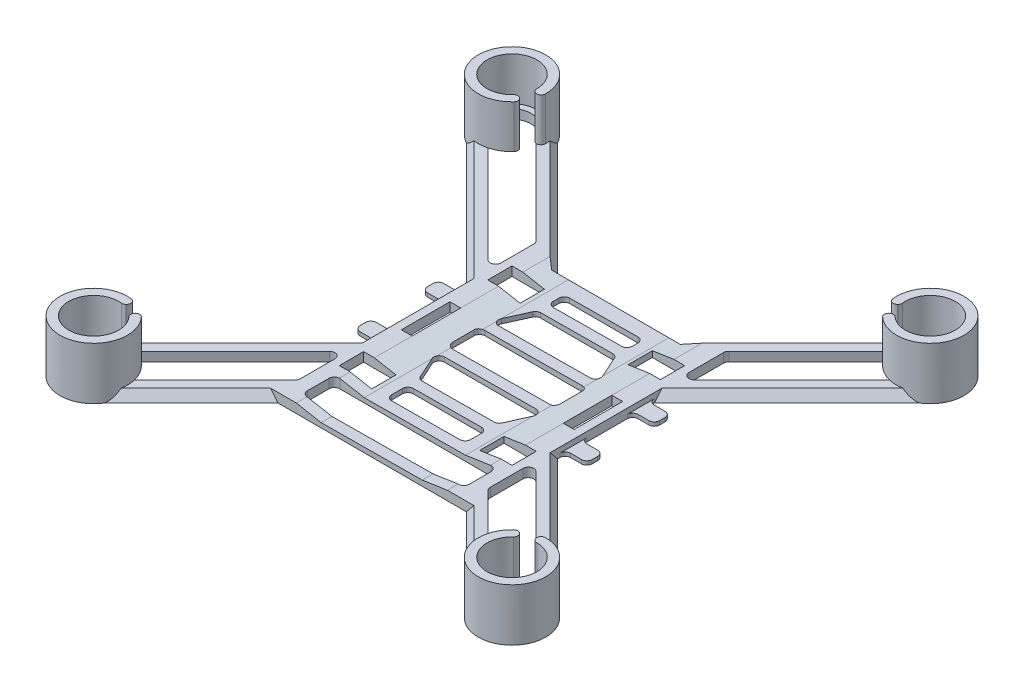
from build123d import *
from build123d.topology import SkipClean

# Parameters (mm, degrees)
ESBO_O1_W                = 90
ESBO_O1_H                = 90
RESSALTO_EXTRUS_O1_DEPTH = 1.7
ESBO_O2_R                = 6.25
ESBO_O2_R_2              = 4.625
RESSALTO_EXTRUS_O2_DEPTH = 8
FILETE1_R                = 6.25
CORTE_EXTRUS_O1_DEPTH    = 15
ESBO_O11_W               = 6
ESBO_O11_H               = 4.5
ESBO_O11_W_2             = 2
ESBO_O11_H_2             = 9
CORTE_EXTRUS_O8_DEPTH    = 20
CORTE_EXTRUS_O11_DEPTH   = 23
CHANFRO2_SIZE            = 2
CHANFRO2_SIZE_2          = 1.154700538
ESBO_O23_W               = 4
ESBO_O23_H               = 3
RESSALTO_EXTRUS_O6_DEPTH = 1.7
ESBO_O25_W               = 30
ESBO_O25_H               = 6
ESBO_O25_W_2             = 14.632060808
ESBO_O25_H_2             = 4
ESBO_O25_W_3             = 20
ESBO_O25_H_3             = 3.022980672
CORTE_EXTRUS_O16_DEPTH   = 34
CHANFRO4_SIZE            = 2
CORTE_EXTRUS_O20_DEPTH   = 4
FILETE5_R                = 1
FILETE6_R                = 1
FILETE7_R                = 1
CORTE_EXTRUS_O21_DEPTH   = 85.599955679
ESBO_O30_W               = 4.624602657
ESBO_O30_H               = 17.599663355
ESBO_O30_W_2             = 4.720585126
ESBO_O30_H_2             = 17.916049933
CORTE_EXTRUS_O25_DEPTH   = 1
FILETE8_R                = 0.8


with BuildPart() as part:
    # Esboço1 → Ressalto-extrusão1 (new body)
    with BuildSketch(Plane(origin=(0, 0, 0), x_dir=(1, 0, 0), z_dir=(0, 1, 0))):
        Rectangle(ESBO_O1_W, ESBO_O1_H)
    extrude(amount=RESSALTO_EXTRUS_O1_DEPTH)

    # Esboço2 → Ressalto-extrusão2 (add)
    # profile 1 of 4: a face of its own
    with BuildSketch(Plane(origin=(0, 1.7, 0), x_dir=(1, 0, 0), z_dir=(0, 1, 0))):
        with Locations(Location((-38.75, 38.75, 0), (0, 0, 90))):
            Circle(ESBO_O2_R)
        with Locations(Location((-38.75, 38.75, 0), (0, 0, 270))):
            Circle(ESBO_O2_R_2, mode=Mode.SUBTRACT)
    # profile 2 of 4: a face of its own
    with BuildSketch(Plane(origin=(0, 1.7, 0), x_dir=(1, 0, 0), z_dir=(0, 1, 0))):
        with Locations(Location((38.75, 38.75, 0), (0, 0, 90))):
            Circle(ESBO_O2_R)
        with Locations(Location((38.75, 38.75, 0), (0, 0, 270))):
            Circle(ESBO_O2_R_2, mode=Mode.SUBTRACT)
    # profile 3 of 4: a face of its own
    with BuildSketch(Plane(origin=(0, 1.7, 0), x_dir=(1, 0, 0), z_dir=(0, 1, 0))):
        with Locations(Location((38.75, -38.75, 0), (0, 0, 270))):
            Circle(ESBO_O2_R)
        with Locations(Location((38.75, -38.75, 0), (0, 0, 270))):
            Circle(ESBO_O2_R_2, mode=Mode.SUBTRACT)
    # profile 4 of 4: a face of its own
    with BuildSketch(Plane(origin=(0, 1.7, 0), x_dir=(1, 0, 0), z_dir=(0, 1, 0))):
        with Locations(Location((-38.75, -38.75, 0), (0, 0, 270))):
            Circle(ESBO_O2_R)
        with Locations(Location((-38.75, -38.75, 0), (0, 0, 270))):
            Circle(ESBO_O2_R_2, mode=Mode.SUBTRACT)
    extrude(amount=RESSALTO_EXTRUS_O2_DEPTH)

    # Filete1
    filete1_edges = [part.edges().sort_by_distance(p)[0] for p in [
        (-45, 0.85, -45),
        (45, 0.85, -45),
        (45, 0.85, 45),
        (-45, 0.85, 45),
    ]]
    fillet(filete1_edges, radius=FILETE1_R)

    # Esboço3 → Corte-extrusão1 (cut)
    with BuildSketch(Plane(origin=(0, 1.7, 0), x_dir=(1, 0, 0), z_dir=(0, 1, 0))):
        Polygon((0.306619532, 3.948336601), (37.223452225, 40.865169294), (38.637665788, 39.450955731), (1.720833095, 2.534123038), (40.877478067, -36.622521933), (39.463264504, -38.036735496), (0.306619532, 1.119909476), (-39.356434012, -38.543144069), (-40.770647575, -37.128930506), (-1.10759403, 2.534123038), (-37.799805314, 39.226334322), (-36.385591752, 40.640547885), align=None)
    extrude(amount=CORTE_EXTRUS_O1_DEPTH, mode=Mode.SUBTRACT)

    # Esboço11 → Corte-extrusão8 (cut)
    with BuildSketch(Plane(origin=(0, 1.7, 0), x_dir=(1, 0, 0), z_dir=(0, 1, 0))):
        with Locations((-13, -13.75)):
            Rectangle(ESBO_O11_W, ESBO_O11_H)
        with Locations((-15, 0)):
            Rectangle(ESBO_O11_W_2, ESBO_O11_H_2)
        with Locations((-13, 13.75)):
            Rectangle(ESBO_O11_W, ESBO_O11_H)
        with Locations((13, -13.75)):
            Rectangle(ESBO_O11_W, ESBO_O11_H)
        with Locations((15, 0)):
            Rectangle(ESBO_O11_W_2, ESBO_O11_H_2)
        with Locations((13, 13.75)):
            Rectangle(ESBO_O11_W, ESBO_O11_H)
    extrude(amount=-CORTE_EXTRUS_O8_DEPTH, mode=Mode.SUBTRACT)

    # Esboço14 → Corte-extrusão11 (cut)
    with SkipClean():  # the faces are left unmerged after this step: merging them gives an invalid solid
        with BuildSketch(Plane(origin=(0, 1.7, 0), x_dir=(1, 0, 0), z_dir=(0, 1, 0))):
            with BuildLine():
                Line((-45, 38.75), (-45, -38.75))
                ThreePointArc((-45, -38.75), (-44.494719449, -36.288151415), (-43.060576494, -34.224358577))
                Line((-43.060576494, -34.224358577), (-17.5, -8.663782083))
                Line((-17.5, -8.663782083), (-17.5, 8.814606578))
                Line((-17.5, 8.814606578), (-42.27279716, 33.587403737))
                ThreePointArc((-42.27279716, 33.587403737), (-44.276299949, 35.830666365), (-45, 38.75))
            make_face()
            with BuildLine():
                Line((38.75, 45), (-38.75, 45))
                ThreePointArc((-38.75, 45), (-35.830666365, 44.276299949), (-33.587403737, 42.27279716))
                Line((-33.587403737, 42.27279716), (-12.314606578, 21))
                Line((-12.314606578, 21), (12.163782083, 21))
                Line((12.163782083, 21), (34.224358577, 43.060576494))
                ThreePointArc((34.224358577, 43.060576494), (36.288151415, 44.494719449), (38.75, 45))
            make_face()
            with BuildLine():
                Line((17.5, -8.814606578), (42.27279716, -33.587403737))
                ThreePointArc((42.27279716, -33.587403737), (44.276299949, -35.830666365), (45, -38.75))
                Line((45, -38.75), (45, 38.75))
                ThreePointArc((45, 38.75), (44.494719449, 36.288151415), (43.060576494, 34.224358577))
                Line((43.060576494, 34.224358577), (17.5, 8.663782083))
                Line((17.5, 8.663782083), (17.5, -8.814606578))
            make_face()
            with BuildLine():
                Line((-17.143092455, -25.979310372), (-34.224358577, -43.060576494))
                ThreePointArc((-34.224358577, -43.060576494), (-36.288151415, -44.494719449), (-38.75, -45))
                Line((-38.75, -45), (38.75, -45))
                ThreePointArc((38.75, -45), (35.830666365, -44.276299949), (33.587403737, -42.27279716))
                Line((33.587403737, -42.27279716), (17.293916949, -25.979310372))
                Line((17.293916949, -25.979310372), (-17.143092455, -25.979310372))
            make_face()
        extrude(amount=-CORTE_EXTRUS_O11_DEPTH, mode=Mode.SUBTRACT)

    # Chanfro2
    # the kernel refuses this chamfer: 2, 1.154700538 mm, written as the material it takes off along each edge
    with BuildSketch(Plane(origin=(13.841308239, 1.7, 5.155914816), x_dir=(0.013666087023143484, -0.9998132206222079, -0.013666087023143503), z_dir=(0.7071067811865481, 0, 0.7071067811865471))) as chanfro2_piece_1_section:
        Polygon((CHANFRO2_SIZE * 0.999813220622, -CHANFRO2_SIZE * 0.0193267656127), (-CHANFRO2_SIZE_2 * 0.019326765619, -CHANFRO2_SIZE_2 * 0.999813220951), (0, 0), align=None)
    chanfro2_piece_1 = extrude(amount=45.38236874, mode=Mode.PRIVATE)
    chanfro2_piece_1 = chanfro2_piece_1 - Plane(origin=(38.75, 1.053820833, 38.75), x_dir=(0.5636475455879814, 0, -0.8260154020069145), z_dir=(0, 1, 0)) * Cylinder(6.25, 99, mode=Mode.PRIVATE)
    chanfro2_piece_1 = split(chanfro2_piece_1, bisect_by=Plane(origin=(17.5, 1.053820833, 21.194590226), z_dir=(1, 0, 0)), keep=Keep.TOP, mode=Mode.PRIVATE)
    add(chanfro2_piece_1, mode=Mode.SUBTRACT)
    with BuildSketch(Plane(origin=(-46.719268256, 1.7, 37.883050339), x_dir=(-0.01366608702314486, -0.9998132206222079, -0.01366608702314513), z_dir=(0.7071067811865546, 0, -0.7071067811865406))) as chanfro2_piece_2_section:
        Polygon((CHANFRO2_SIZE * 0.999813220622, -CHANFRO2_SIZE * 0.0193267656127), (-CHANFRO2_SIZE_2 * 0.0193267656191, -CHANFRO2_SIZE_2 * 0.999813220951), (0, 0), align=None)
    chanfro2_piece_2 = extrude(amount=46.496456959, mode=Mode.PRIVATE)
    chanfro2_piece_2 = split(chanfro2_piece_2, bisect_by=Plane(origin=(-17.5, 1.053166825, 21.199518697), z_dir=(-1, 0, 0)), keep=Keep.TOP, mode=Mode.PRIVATE)
    chanfro2_piece_2 = chanfro2_piece_2 - Plane(origin=(-38.75, 1.053166825, 38.75), x_dir=(-1, 0, 0), z_dir=(0, 1, 0)) * Cylinder(6.25, 101, mode=Mode.PRIVATE)
    add(chanfro2_piece_2, mode=Mode.SUBTRACT)
    with BuildSketch(Plane(origin=(-37.246095499, 1.7, -45.931488921), x_dir=(0.013666087023144997, -0.9998132206222079, -0.013666087023144993), z_dir=(0.7071067811865475, 0, 0.7071067811865477))) as chanfro2_piece_3_section:
        Polygon((CHANFRO2_SIZE * 0.999813220622, -CHANFRO2_SIZE * 0.0193267656127), (-CHANFRO2_SIZE_2 * 0.0193267656191, -CHANFRO2_SIZE_2 * 0.999813220951), (0, 0), align=None)
    chanfro2_piece_3 = extrude(amount=40.432621272, mode=Mode.PRIVATE)
    chanfro2_piece_3 = chanfro2_piece_3 - Plane(origin=(-38.75, 1.052848375, -38.75), x_dir=(0, 0, -1), z_dir=(0, 1, 0)) * Cylinder(6.25, 89, mode=Mode.PRIVATE)
    chanfro2_piece_3 = split(chanfro2_piece_3, bisect_by=Plane(origin=(-22.944314713, 1.052848375, -21), z_dir=(0, 0, -1)), keep=Keep.TOP, mode=Mode.PRIVATE)
    add(chanfro2_piece_3, mode=Mode.SUBTRACT)
    with BuildSketch(Plane(origin=(8.505090322, 1.7, -17.341308239), x_dir=(-0.013666087023142625, -0.9998132206222079, -0.013666087023143075), z_dir=(0.7071067811865591, 0, -0.7071067811865359))) as chanfro2_piece_4_section:
        Polygon((CHANFRO2_SIZE * 0.999813220622, -CHANFRO2_SIZE * 0.0193267656127), (-CHANFRO2_SIZE_2 * 0.019326765619, -CHANFRO2_SIZE_2 * 0.999813220951), (0, 0), align=None)
    chanfro2_piece_4 = extrude(amount=41.546709491, mode=Mode.PRIVATE)
    chanfro2_piece_4 = chanfro2_piece_4 - Plane(origin=(38.75, 1.052097169, -38.75), x_dir=(-0.7241026276337036, 0, -0.6896922390849168), z_dir=(0, 1, 0)) * Cylinder(6.25, 92, mode=Mode.PRIVATE)
    chanfro2_piece_4 = split(chanfro2_piece_4, bisect_by=Plane(origin=(22.9494905, 1.052097169, -21), z_dir=(0, 0, -1)), keep=Keep.TOP, mode=Mode.PRIVATE)
    add(chanfro2_piece_4, mode=Mode.SUBTRACT)
    with BuildSketch(Plane(origin=(-13.841308239, 1.7, -5.155914816), x_dir=(-0.01366608702314327, -0.9998132206222079, 0.013666087023143286), z_dir=(-0.7071067811865479, 0, -0.7071067811865471))) as chanfro2_piece_5_section:
        Polygon((CHANFRO2_SIZE * 0.999813220622, -CHANFRO2_SIZE * 0.0193267656127), (-CHANFRO2_SIZE_2 * 0.019326765619, -CHANFRO2_SIZE_2 * 0.999813220951), (0, 0), align=None)
    chanfro2_piece_5 = extrude(amount=45.38236874, mode=Mode.PRIVATE)
    chanfro2_piece_5 = chanfro2_piece_5 - Plane(origin=(-38.75, 1.053820833, -38.75), x_dir=(-0.5636475455879961, 0, 0.8260154020069045), z_dir=(0, 1, 0)) * Cylinder(6.25, 99, mode=Mode.PRIVATE)
    chanfro2_piece_5 = split(chanfro2_piece_5, bisect_by=Plane(origin=(-17.5, 1.053820833, -21.194590226), z_dir=(-1, 0, 0)), keep=Keep.TOP, mode=Mode.PRIVATE)
    add(chanfro2_piece_5, mode=Mode.SUBTRACT)
    with BuildSketch(Plane(origin=(46.719268256, 1.7, -37.883050339), x_dir=(0.013666087023146853, -0.9998132206222079, 0.013666087023146572), z_dir=(-0.7071067811865402, 0, 0.7071067811865549))) as chanfro2_piece_6_section:
        Polygon((CHANFRO2_SIZE * 0.999813220622, -CHANFRO2_SIZE * 0.0193267656127), (-CHANFRO2_SIZE_2 * 0.0193267656191, -CHANFRO2_SIZE_2 * 0.999813220951), (0, 0), align=None)
    chanfro2_piece_6 = extrude(amount=46.496456959, mode=Mode.PRIVATE)
    chanfro2_piece_6 = split(chanfro2_piece_6, bisect_by=Plane(origin=(17.5, 1.053166825, -21.199518697), z_dir=(1, 0, 0)), keep=Keep.TOP, mode=Mode.PRIVATE)
    chanfro2_piece_6 = chanfro2_piece_6 - Plane(origin=(38.75, 1.053166825, -38.75), x_dir=(1, 0, 0), z_dir=(0, 1, 0)) * Cylinder(6.25, 101, mode=Mode.PRIVATE)
    add(chanfro2_piece_6, mode=Mode.SUBTRACT)
    with BuildSketch(Plane(origin=(37.246095499, 1.7, 45.931488921), x_dir=(-0.013666087023144995, -0.9998132206222079, 0.013666087023144995), z_dir=(-0.7071067811865476, 0, -0.7071067811865476))) as chanfro2_piece_7_section:
        Polygon((CHANFRO2_SIZE * 0.999813220622, -CHANFRO2_SIZE * 0.0193267656127), (-CHANFRO2_SIZE_2 * 0.0193267656191, -CHANFRO2_SIZE_2 * 0.999813220951), (0, 0), align=None)
    chanfro2_piece_7 = extrude(amount=33.390813013, mode=Mode.PRIVATE)
    chanfro2_piece_7 = split(chanfro2_piece_7, bisect_by=Plane(origin=(25.433358905, 1.050691799, 25.979310372), z_dir=(0, 0, 1)), keep=Keep.TOP, mode=Mode.PRIVATE)
    chanfro2_piece_7 = chanfro2_piece_7 - Plane(origin=(38.75, 1.050691799, 38.75), x_dir=(0, 0, 1), z_dir=(0, 1, 0)) * Cylinder(6.25, 75, mode=Mode.PRIVATE)
    add(chanfro2_piece_7, mode=Mode.SUBTRACT)
    with BuildSketch(Plane(origin=(-13.484400694, 1.7, 22.320618611), x_dir=(0.013666087023143193, -0.9998132206222079, 0.013666087023143364), z_dir=(-0.707106781186552, 0, 0.7071067811865431))) as chanfro2_piece_8_section:
        Polygon((CHANFRO2_SIZE * 0.999813220622, -CHANFRO2_SIZE * 0.0193267656127), (-CHANFRO2_SIZE_2 * 0.019326765619, -CHANFRO2_SIZE_2 * 0.999813220951), (0, 0), align=None)
    chanfro2_piece_8 = extrude(amount=34.504901231, mode=Mode.PRIVATE)
    chanfro2_piece_8 = chanfro2_piece_8 - Plane(origin=(-38.75, 1.049741993, 38.75), x_dir=(0.7241026276342443, 0, 0.6896922390843492), z_dir=(0, 1, 0)) * Cylinder(6.25, 78, mode=Mode.PRIVATE)
    chanfro2_piece_8 = split(chanfro2_piece_8, bisect_by=Plane(origin=(-25.439083602, 1.049741993, 25.979310372), z_dir=(0, 0, 1)), keep=Keep.TOP, mode=Mode.PRIVATE)
    add(chanfro2_piece_8, mode=Mode.SUBTRACT)

    # Esboço23 → Ressalto-extrusão6 (add)
    with BuildSketch(Plane(origin=(0, 1.7, 0), x_dir=(1, 0, 0), z_dir=(0, 1, 0))):
        with Locations((-19.5, 6.356494381)):
            Rectangle(ESBO_O23_W, ESBO_O23_H)
        with Locations((19.5, 6.356494381)):
            Rectangle(ESBO_O23_W, ESBO_O23_H)
        with Locations((-19.5, -6.132098225)):
            Rectangle(ESBO_O23_W, ESBO_O23_H)
        with Locations((19.5, -6.132098225)):
            Rectangle(ESBO_O23_W, ESBO_O23_H)
    extrude(amount=-RESSALTO_EXTRUS_O6_DEPTH)

    # Esboço25 → Corte-extrusão16 (cut)
    with BuildSketch(Plane(origin=(0, 1.7, 0), x_dir=(1, 0, 0), z_dir=(0, 1, 0))):
        with Locations((0.075412247, -20.979310372)):
            Rectangle(ESBO_O25_W, ESBO_O25_H)
        with Locations((0, -13.979310372)):
            Rectangle(ESBO_O25_W_2, ESBO_O25_H_2)
        Polygon((-10.032961397, -4.013772222), (10, -4.013772222), (7.316030404, -9.979310372), (-7.316030404, -9.979310372), align=None)
        with Locations((0, 0.986227778)):
            Rectangle(ESBO_O25_W_3, ESBO_O25_H)
        Polygon((-7.316030404, 11.977019328), (7.316030404, 11.977019328), (10.015528784, 5.986227778), (-10.015528784, 5.986227778), align=None)
        with Locations((0, 15.488509664)):
            Rectangle(ESBO_O25_W_2, ESBO_O25_H_3)
    extrude(amount=-CORTE_EXTRUS_O16_DEPTH, mode=Mode.SUBTRACT)

    # Chanfro4
    # the kernel refuses this chamfer: 2 mm, written as the material it takes off along each edge
    with BuildSketch(Plane(origin=(18.940141221, 1.7, -21), x_dir=(0, 0.027495876610586403, 0.9996219169112968), z_dir=(-1, 0, 0))) as chanfro4_piece_1_section:
        Polygon((CHANFRO4_SIZE * 0.999621916911, -CHANFRO4_SIZE * 0.0274958766106), (-CHANFRO4_SIZE * 0.0274958766106, -CHANFRO4_SIZE * 0.999621916911), (0, 0), align=None)
    chanfro4_piece_1 = extrude(amount=38.031106936, mode=Mode.PRIVATE)
    chanfro4_piece_1 = split(chanfro4_piece_1, bisect_by=Plane(origin=(-4.834145698, -2.83942723, -15.592972772), z_dir=(0.6123724356957746, 0.5000000000000488, -0.6123724356957746)), keep=Keep.TOP, mode=Mode.PRIVATE)
    chanfro4_piece_1 = split(chanfro4_piece_1, bisect_by=Plane(origin=(4.683321204, -2.83942723, -15.592972772), z_dir=(-0.612372435695766, 0.5000000000000697, -0.612372435695766)), keep=Keep.TOP, mode=Mode.PRIVATE)
    add(chanfro4_piece_1, mode=Mode.SUBTRACT)

    # Esboço17 → Corte-extrusão20 (cut)
    with BuildSketch(Plane(origin=(0, 1.7, 0), x_dir=(1, 0, 0), z_dir=(0, 1, 0))):
        with BuildLine():
            Line((-40.12496322, -35.53138599), (-17.5, -12.90642277))
            Line((-17.5, -12.90642277), (-17.5, -22.09357723))
            Line((-17.5, -22.09357723), (-35.53138599, -40.12496322))
            ThreePointArc((-35.53138599, -40.12496322), (-41.224873734, -41.224873734), (-40.12496322, -35.53138599))
        make_face()
        with BuildLine():
            Line((-17.5, 13.057247265), (-17.5, 21.942752735))
            Line((-17.5, 21.942752735), (-35.437529212, 39.880281948))
            ThreePointArc((-35.437529212, 39.880281948), (-41.224873734, 41.224873734), (-39.880281948, 35.437529212))
            Line((-39.880281948, 35.437529212), (-17.5, 13.057247265))
        make_face()
        with BuildLine():
            Line((17.5, -21.942752735), (17.5, -13.057247265))
            Line((17.5, -13.057247265), (39.880281948, -35.437529212))
            ThreePointArc((39.880281948, -35.437529212), (41.224873734, -41.224873734), (35.437529212, -39.880281948))
            Line((35.437529212, -39.880281948), (17.5, -21.942752735))
        make_face()
        with BuildLine():
            Line((17.5, 12.90642277), (40.12496322, 35.53138599))
            ThreePointArc((40.12496322, 35.53138599), (41.224873734, 41.224873734), (35.53138599, 40.12496322))
            Line((35.53138599, 40.12496322), (17.5, 22.09357723))
            Line((17.5, 22.09357723), (17.5, 12.90642277))
        make_face()
    extrude(amount=-CORTE_EXTRUS_O20_DEPTH, mode=Mode.SUBTRACT)

    # Filete5
    filete5_edges = [part.edges().sort_by_distance(p)[0] for p in [
        (15.075412247, 0.85, 17.979310372),
        (15.075412247, 0.85, 23.979310372),
        (-14.924587753, 0.85, 23.979310372),
        (-14.924587753, 0.85, 17.979310372),
        (7.316030404, 0.85, 11.979310372),
        (7.316030404, 0.85, 15.979310372),
        (-7.316030404, 0.85, 15.979310372),
        (-7.316030404, 0.85, 11.979310372),
        (10, 0.85, 4.013772222),
        (7.316030404, 0.85, 9.979310372),
        (-7.316030404, 0.85, 9.979310372),
        (-10.032961397, 0.85, 4.013772222),
        (10, 0.85, -3.986227778),
        (10, 0.85, 2.013772222),
        (-10, 0.85, 2.013772222),
        (-10, 0.85, -3.986227778),
        (7.316030404, 0.85, -11.977019328),
        (10.015528784, 0.85, -5.986227778),
        (-10.015528784, 0.85, -5.986227778),
        (-7.316030404, 0.85, -11.977019328),
        (7.316030404, 0.85, -17),
        (7.316030404, 0.85, -13.977019328),
        (-7.316030404, 0.85, -13.977019328),
        (-7.316030404, 0.85, -17),
    ]]
    fillet(filete5_edges, radius=FILETE5_R)

    # Filete6
    filete6_edges = [part.edges().sort_by_distance(p)[0] for p in [
        (-17.5, 0.85, -7.856494381),
        (-17.5, 0.85, -4.856494381),
        (-17.5, 0.85, 4.632098225),
        (-17.5, 0.85, 7.632098225),
        (17.5, 0.85, -4.856494381),
        (17.5, 0.85, -7.856494381),
        (17.5, 0.85, 7.632098225),
        (17.5, 0.85, 4.632098225),
        (-17.5, 0.85, 12.90642277),
        (-17.5, 0.85, 22.09357723),
        (17.5, 0.85, 21.942752735),
        (17.5, 0.85, 13.057247265),
        (-17.5, 0.85, -21.942752735),
        (-17.5, 0.85, -13.057247265),
        (17.5, 0.85, -12.90642277),
        (17.5, 0.85, -22.09357723),
    ]]
    fillet(filete6_edges, radius=FILETE6_R)

    # Filete7
    filete7_edges = [part.edges().sort_by_distance(p)[0] for p in [
        (-21.5, 0.85, -4.856494381),
        (-21.5, 0.85, -7.856494381),
        (-21.5, 0.85, 7.632098225),
        (-21.5, 0.85, 4.632098225),
        (21.5, 0.85, -7.856494381),
        (21.5, 0.85, -4.856494381),
        (21.5, 0.85, 4.632098225),
        (21.5, 0.85, 7.632098225),
    ]]
    fillet(filete7_edges, radius=FILETE7_R)

    # Esboço26 → Corte-extrusão21 (cut, through all)
    with BuildSketch(Plane.XY.offset(25.979310372)):
        Polygon((-14, 1.7), (14, 1.7), (9.36548933, 1), (-9.388755792, 0.85), align=None)
    extrude(amount=-CORTE_EXTRUS_O21_DEPTH, mode=Mode.SUBTRACT)

    # Esboço30 → Corte-extrusão25 (cut)
    with BuildSketch(Plane(origin=(0, 1.7, 0), x_dir=(1, 0, 0), z_dir=(0, 1, 0))):
        with Locations((-19.812301328, 0.056662703)):
            Rectangle(ESBO_O30_W, ESBO_O30_H)
        with Locations((19.860292563, -0.101530585)):
            Rectangle(ESBO_O30_W_2, ESBO_O30_H_2)
    extrude(amount=-CORTE_EXTRUS_O25_DEPTH, mode=Mode.SUBTRACT)

    # Filete8
    # the kernel refuses this fillet: 0.8 mm, written as the material it takes off along each edge
    with BuildSketch(Plane(origin=(-34.75597572, 11.783212034, 33.942685776), x_dir=(-0.7071067811865429, 0, 0.707106781186552), z_dir=(0, -1, 0))) as filete8_piece_1:
        with BuildLine():
            CenterArc((0.778129194, -0.8), FILETE8_R, 90, 92.365222966)
            ThreePointArc((-0.021189257, -0.833015364), (-0.024492867, -0.416154155), (0, 0))
            Line((0, 0), (0.778129194, 0))
        make_face()
    extrude(amount=12.166424069, mode=Mode.SUBTRACT)
    with BuildSketch(Plane(origin=(35.101784968, 11.63310656, 33.675255959), x_dir=(0.7071067811865475, 0, 0.7071067811865475), z_dir=(0, -1, 0))) as filete8_piece_2:
        with BuildLine():
            CenterArc((0.722061233, 0.8), FILETE8_R, 182.194684676, 87.805315324)
            ThreePointArc((-0.077351946, 0.769363914), (-0.050585476, 0.383484574), (0, 0))
            Line((0, 0), (0.722061233, 0))
        make_face()
    extrude(amount=11.866213121, mode=Mode.SUBTRACT)
    with BuildSketch(Plane(origin=(37.003838037, 13.929767494, 32.748881904), x_dir=(0.7071067811865498, 0, 0.7071067811865454), z_dir=(0, -1, 0))) as filete8_piece_3:
        with BuildLine():
            CenterArc((1.579918662, -0.8), FILETE8_R, 90, 134.334456833)
            ThreePointArc((1.007700592, -1.359076453), (0.457649093, -0.713794562), (0, 0))
            Line((0, 0), (1.579918662, 0))
        make_face()
    extrude(amount=12.229767494, mode=Mode.SUBTRACT)
    with BuildSketch(Plane(origin=(33.942685776, 11.783212034, -34.75597572), x_dir=(0.7071067811865475, 0, -0.7071067811865475), z_dir=(0, -1, 0))) as filete8_piece_4:
        with BuildLine():
            CenterArc((0.778129194, 0.8), FILETE8_R, 177.634777034, 92.365222966)
            ThreePointArc((-0.021189257, 0.833015364), (-0.024492867, 0.416154155), (0, 0))
            Line((0, 0), (0.778129194, 0))
        make_face()
    extrude(amount=12.166424069, mode=Mode.SUBTRACT)
    with BuildSketch(Plane(origin=(32.902266226, 13.490091535, -36.543983294), x_dir=(0.7071067811865476, 0, -0.7071067811865476), z_dir=(0, -1, 0))) as filete8_piece_5:
        with BuildLine():
            CenterArc((1.415689245, -0.8), FILETE8_R, 90, 128.26366681)
            ThreePointArc((0.787553856, -1.295425003), (0.35435318, -0.671680176), (0, 0))
            Line((0, 0), (1.415689245, 0))
        make_face()
    extrude(amount=11.790091535, mode=Mode.SUBTRACT)
    with BuildSketch(Plane(origin=(-32.748881904, 13.929767494, -37.003838037), x_dir=(-0.7071067811865476, 0, -0.7071067811865476), z_dir=(0, -1, 0))) as filete8_piece_6:
        with BuildLine():
            CenterArc((1.579918662, 0.8), FILETE8_R, 135.665543167, 134.334456833)
            ThreePointArc((1.007700592, 1.359076453), (0.457649093, 0.713794562), (0, 0))
            Line((0, 0), (1.579918662, 0))
        make_face()
    extrude(amount=12.229767494, mode=Mode.SUBTRACT)
    with BuildSketch(Plane(origin=(-34.84509544, 11.968307975, -36.271624448), x_dir=(-0.6101298708364825, 0, 0.7923014203654168), z_dir=(0, -1, 0))) as filete8_piece_7:
        with BuildLine():
            CenterArc((0.91021154, -0.796712196), FILETE8_R, 95.196302522, 92.204803414)
            Line((0.116876599, -0.899763987), (0, 0))
            ThreePointArc((0, 0), (0.418878445, -0.019007615), (0.83775689, 0))
        make_face()
    extrude(amount=12.53661595, mode=Mode.SUBTRACT)
    with BuildSketch(Plane(origin=(-34.138744654, 10.5765379, -38.393700787), x_dir=(0.04209634155438846, 0, -0.9991135561224942), z_dir=(0, -1, 0))) as filete8_piece_8:
        with BuildLine():
            CenterArc((0.3517313, 0.799509902), FILETE8_R, 222.587344359, 45.407000383)
            Line((-0.237265964, 0.258139212), (0, 0))
            ThreePointArc((0, 0), (0.161866394, 0.002833379), (0.323732788, 0))
        make_face()
    extrude(amount=8.8765379, mode=Mode.SUBTRACT)
    with BuildSketch(Plane(origin=(35.09836622, 11.778070871, -35.911656163), x_dir=(0.6770902124368167, 0, 0.7359000232519812), z_dir=(0, -1, 0))) as filete8_piece_9:
        with BuildLine():
            CenterArc((0.83387446, 0.797241464), FILETE8_R, 177.616678301, 87.623871151)
            Line((0.034566478, 0.830509317), (0, 0))
            ThreePointArc((0, 0), (0.383748197, 0.015947785), (0.767496393, 0))
        make_face()
    extrude(amount=12.156141742, mode=Mode.SUBTRACT)
    with BuildSketch(Plane(origin=(34.212565183, 10.71366818, -37.854282252), x_dir=(-0.15380286165667637, 0, -0.9881015533568487), z_dir=(0, -1, 0))) as filete8_piece_10:
        with BuildLine():
            CenterArc((0.406758026, -0.799344492), FILETE8_R, 92.319590615, 51.527782146)
            Line((-0.239200658, -0.327393882), (0, 0))
            ThreePointArc((0, 0), (0.187189639, -0.003789656), (0.374379278, 0))
        make_face()
    extrude(amount=10.02733636, mode=Mode.SUBTRACT)
    with BuildSketch(Plane(origin=(36.271624448, 11.968307975, 34.84509544), x_dir=(-0.7923014203654168, 0, 0.6101298708364825), z_dir=(0, -1, 0))) as filete8_piece_11:
        with BuildLine():
            CenterArc((0.91021154, 0.796712196), FILETE8_R, 172.598894064, 92.204803414)
            Line((0.116876599, 0.899763987), (0, 0))
            ThreePointArc((0, 0), (0.418878445, 0.019007615), (0.83775689, 0))
        make_face()
    extrude(amount=12.53661595, mode=Mode.SUBTRACT)
    with BuildSketch(Plane(origin=(38.393700787, 10.5765379, 34.138744654), x_dir=(0.9991135561224941, 0, -0.04209634155438753), z_dir=(0, -1, 0))) as filete8_piece_12:
        with BuildLine():
            CenterArc((0.3517313, -0.799509902), FILETE8_R, 92.005655257, 45.407000383)
            Line((-0.237265964, -0.258139212), (0, 0))
            ThreePointArc((0, 0), (0.161866394, -0.002833379), (0.323732788, 0))
        make_face()
    extrude(amount=8.8765379, mode=Mode.SUBTRACT)
    with BuildSketch(Plane(origin=(-37.854282252, 10.71366818, 34.212565183), x_dir=(-0.9881015533568496, 0, -0.1538028616566706), z_dir=(0, -1, 0))) as filete8_piece_13:
        with BuildLine():
            CenterArc((0.406758026, 0.799344492), FILETE8_R, 216.152627239, 51.527782146)
            Line((-0.239200658, 0.327393882), (0, 0))
            ThreePointArc((0, 0), (0.187189639, 0.003789656), (0.374379278, 0))
        make_face()
    extrude(amount=10.02733636, mode=Mode.SUBTRACT)
    with BuildSketch(Plane(origin=(-35.911656163, 11.778070871, 35.09836622), x_dir=(0.7359000232519816, 0, 0.6770902124368162), z_dir=(0, -1, 0))) as filete8_piece_14:
        with BuildLine():
            CenterArc((0.83387446, -0.797241464), FILETE8_R, 94.759450548, 87.623871151)
            Line((0.034566478, -0.830509317), (0, 0))
            ThreePointArc((0, 0), (0.383748197, -0.015947785), (0.767496393, 0))
        make_face()
    extrude(amount=12.156141742, mode=Mode.SUBTRACT)
    with BuildSketch(Plane(origin=(-33.675255959, 11.63310656, -35.101784968), x_dir=(-0.7071067811865475, 0, -0.7071067811865475), z_dir=(0, -1, 0))) as filete8_piece_15:
        with BuildLine():
            CenterArc((0.722061233, -0.8), FILETE8_R, 90, 87.805315324)
            ThreePointArc((-0.077351946, -0.769363914), (-0.050585476, -0.383484574), (0, 0))
            Line((0, 0), (0.722061233, 0))
        make_face()
    extrude(amount=11.866213121, mode=Mode.SUBTRACT)
    with BuildSketch(Plane(origin=(-36.543983294, 13.490091535, 32.902266226), x_dir=(-0.7071067811865476, 0, 0.7071067811865476), z_dir=(0, -1, 0))) as filete8_piece_16:
        with BuildLine():
            CenterArc((1.415689245, 0.8), FILETE8_R, 141.73633319, 128.26366681)
            ThreePointArc((0.787553856, 1.295425003), (0.35435318, 0.671680176), (0, 0))
            Line((0, 0), (1.415689245, 0))
        make_face()
    extrude(amount=11.790091535, mode=Mode.SUBTRACT)


solid = part.part
